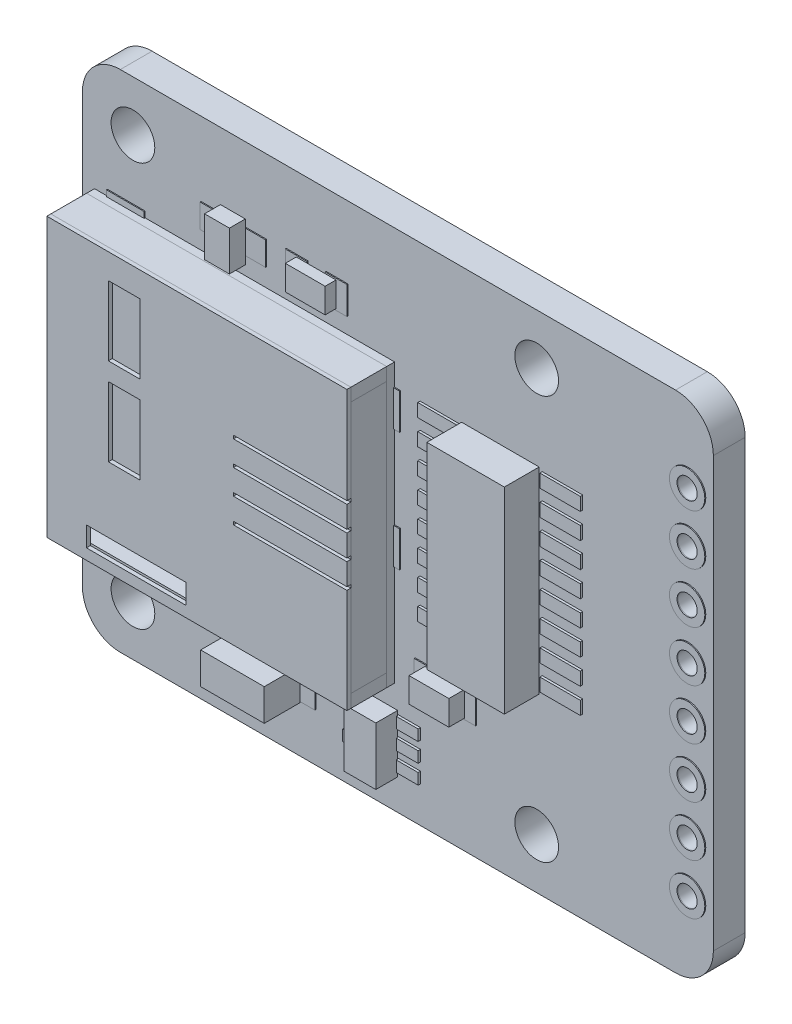
from build123d import *

# Parameters (mm, degrees)
ESQUISSE1_R                                    = 1.1
ESQUISSE1_R_2                                  = 0.508
PCB_ADAFRUIT_EAGLE_31_75X25_4_EP_ESTIMEE_DEPTH = 1.6
MICROSD_BASE_H_ESTIMEE_START                   = 1.6
ESQUISSE2_W                                    = 15.1
ESQUISSE2_H                                    = 14
MICROSD_BASE_H_ESTIMEE_DEPTH                   = 0.4
MICROSD_FLANCS_START                           = 2
ESQUISSE3_W                                    = 15.1
ESQUISSE3_H                                    = 0.65
MICROSD_FLANCS_DEPTH                           = 1.8
MICROSD_FLANCS_2_DEPTH                         = 1.8
MICROSD_FOND_START                             = 2
ESQUISSE4_W                                    = 0.65
ESQUISSE4_H                                    = 12.7
MICROSD_FOND_DEPTH                             = 1.8
MICROSD_CAPOT_METALLIQUE_START                 = 3.8
ESQUISSE5_W                                    = 15.1
ESQUISSE5_H                                    = 14
MICROSD_CAPOT_METALLIQUE_DEPTH                 = 0.2
FENETRES_CAPOT_SIMPLIFIEES_START               = 4
ESQUISSE6_W                                    = 1.6
ESQUISSE6_H                                    = 3.5
ESQUISSE6_W_2                                  = 5
ESQUISSE6_H_2                                  = 1
FENETRES_CAPOT_SIMPLIFIEES_DEPTH               = 0.2
FENTES_CAPOT_SIMPLIFIEES_START                 = 4
ESQUISSE7_W                                    = 5.8
ESQUISSE7_H                                    = 0.16
FENTES_CAPOT_SIMPLIFIEES_DEPTH                 = 0.2
CONTACTS_MICROSD_SIMPLIFIES_START              = 2
ESQUISSE8_W                                    = 5
ESQUISSE8_H                                    = 0.35
CONTACTS_MICROSD_SIMPLIFIES_DEPTH              = 0.12
CONTACTS_MICROSD_SIMPLIFIES_2_DEPTH            = 0.12
CONTACTS_MICROSD_SIMPLIFIES_3_DEPTH            = 0.12
CONTACTS_MICROSD_SIMPLIFIES_4_DEPTH            = 0.12
CONTACTS_MICROSD_SIMPLIFIES_5_DEPTH            = 0.12
CONTACTS_MICROSD_SIMPLIFIES_6_DEPTH            = 0.12
CONTACTS_MICROSD_SIMPLIFIES_7_DEPTH            = 0.12
CONTACTS_MICROSD_SIMPLIFIES_8_DEPTH            = 0.12
IC1_POSITION_EAGLE_START                       = 1.65
ESQUISSE9_W                                    = 3.9
ESQUISSE9_H                                    = 9.9
IC1_POSITION_EAGLE_DEPTH                       = 1.75
IC2_POSITION_EAGLE_START                       = 1.65
ESQUISSE10_W                                   = 1.6
ESQUISSE10_H                                   = 2.9
IC2_POSITION_EAGLE_DEPTH                       = 1.1
C1_POSITION_EAGLE_START                        = 1.65
ESQUISSE11_W                                   = 3.2
ESQUISSE11_H                                   = 1.6
C1_POSITION_EAGLE_DEPTH                        = 1.8
C2_POSITION_EAGLE_START                        = 1.65
ESQUISSE12_W                                   = 2
ESQUISSE12_H                                   = 1.25
C2_POSITION_EAGLE_DEPTH                        = 0.8
ACT_POSITION_EAGLE_START                       = 1.65
ESQUISSE13_W                                   = 1.25
ESQUISSE13_H                                   = 2
ACT_POSITION_EAGLE_DEPTH                       = 0.8
R1_POSITION_EAGLE_START                        = 1.65
ESQUISSE14_W                                   = 2
ESQUISSE14_H                                   = 1.25
R1_POSITION_EAGLE_DEPTH                        = 0.55
PAD_IC1_0_START                                = 1.6
ESQUISSE15_W                                   = 2.032
ESQUISSE15_H                                   = 0.6604
PAD_IC1_0_DEPTH                                = 0.12
PAD_IC1_1_START                                = 1.6
ESQUISSE16_W                                   = 2.032
ESQUISSE16_H                                   = 0.6604
PAD_IC1_1_DEPTH                                = 0.12
PAD_IC1_2_START                                = 1.6
ESQUISSE17_W                                   = 2.032
ESQUISSE17_H                                   = 0.6604
PAD_IC1_2_DEPTH                                = 0.12
PAD_IC1_3_START                                = 1.6
ESQUISSE18_W                                   = 2.032
ESQUISSE18_H                                   = 0.6604
PAD_IC1_3_DEPTH                                = 0.12
PAD_IC1_4_START                                = 1.6
ESQUISSE19_W                                   = 2.032
ESQUISSE19_H                                   = 0.6604
PAD_IC1_4_DEPTH                                = 0.12
PAD_IC1_5_START                                = 1.6
ESQUISSE20_W                                   = 2.032
ESQUISSE20_H                                   = 0.6604
PAD_IC1_5_DEPTH                                = 0.12
PAD_IC1_6_START                                = 1.6
ESQUISSE21_W                                   = 2.032
ESQUISSE21_H                                   = 0.6604
PAD_IC1_6_DEPTH                                = 0.12
PAD_IC1_7_START                                = 1.6
ESQUISSE22_W                                   = 2.032
ESQUISSE22_H                                   = 0.6604
PAD_IC1_7_DEPTH                                = 0.12
PAD_IC1_8_START                                = 1.6
ESQUISSE23_W                                   = 2.032
ESQUISSE23_H                                   = 0.6604
PAD_IC1_8_DEPTH                                = 0.12
PAD_IC1_9_START                                = 1.6
ESQUISSE24_W                                   = 2.032
ESQUISSE24_H                                   = 0.6604
PAD_IC1_9_DEPTH                                = 0.12
PAD_IC1_10_START                               = 1.6
ESQUISSE25_W                                   = 2.032
ESQUISSE25_H                                   = 0.6604
PAD_IC1_10_DEPTH                               = 0.12
PAD_IC1_11_START                               = 1.6
ESQUISSE26_W                                   = 2.032
ESQUISSE26_H                                   = 0.6604
PAD_IC1_11_DEPTH                               = 0.12
PAD_IC1_12_START                               = 1.6
ESQUISSE27_W                                   = 2.032
ESQUISSE27_H                                   = 0.6604
PAD_IC1_12_DEPTH                               = 0.12
PAD_IC1_13_START                               = 1.6
ESQUISSE28_W                                   = 2.032
ESQUISSE28_H                                   = 0.6604
PAD_IC1_13_DEPTH                               = 0.12
PAD_IC1_14_START                               = 1.6
ESQUISSE29_W                                   = 2.032
ESQUISSE29_H                                   = 0.6604
PAD_IC1_14_DEPTH                               = 0.12
PAD_IC1_15_START                               = 1.6
ESQUISSE30_W                                   = 2.032
ESQUISSE30_H                                   = 0.6604
PAD_IC1_15_DEPTH                               = 0.12
PAD_X1_0_START                                 = 1.6
ESQUISSE31_W                                   = 1.9
ESQUISSE31_H                                   = 1.4
PAD_X1_0_DEPTH                                 = 0.05
PAD_X1_1_START                                 = 1.6
ESQUISSE32_W                                   = 1.9
ESQUISSE32_H                                   = 1.4
PAD_X1_1_DEPTH                                 = 0.05
PAD_X1_2_START                                 = 1.6
ESQUISSE33_W                                   = 1.4
ESQUISSE33_H                                   = 1.8
PAD_X1_2_DEPTH                                 = 0.05
PAD_X1_3_START                                 = 1.6
ESQUISSE34_W                                   = 1.4
ESQUISSE34_H                                   = 1.8
PAD_X1_3_DEPTH                                 = 0.05
PAD_X1_4_START                                 = 1.6
ESQUISSE35_W                                   = 1.5
ESQUISSE35_H                                   = 0.7
PAD_X1_4_DEPTH                                 = 0.05
PAD_X1_5_START                                 = 1.6
ESQUISSE36_W                                   = 1.5
ESQUISSE36_H                                   = 0.7
PAD_X1_5_DEPTH                                 = 0.05
PAD_X1_6_START                                 = 1.6
ESQUISSE37_W                                   = 1.5
ESQUISSE37_H                                   = 0.7
PAD_X1_6_DEPTH                                 = 0.05
PAD_X1_7_START                                 = 1.6
ESQUISSE38_W                                   = 1.5
ESQUISSE38_H                                   = 0.7
PAD_X1_7_DEPTH                                 = 0.05
PAD_X1_8_START                                 = 1.6
ESQUISSE39_W                                   = 1.5
ESQUISSE39_H                                   = 0.7
PAD_X1_8_DEPTH                                 = 0.05
PAD_X1_9_START                                 = 1.6
ESQUISSE40_W                                   = 1.5
ESQUISSE40_H                                   = 0.7
PAD_X1_9_DEPTH                                 = 0.05
PAD_X1_10_START                                = 1.6
ESQUISSE41_W                                   = 1.5
ESQUISSE41_H                                   = 0.7
PAD_X1_10_DEPTH                                = 0.05
PAD_X1_11_START                                = 1.6
ESQUISSE42_W                                   = 1.5
ESQUISSE42_H                                   = 0.7
PAD_X1_11_DEPTH                                = 0.05
PAD_IC2_0_START                                = 1.6
ESQUISSE43_W                                   = 1.2
ESQUISSE43_H                                   = 0.55
PAD_IC2_0_DEPTH                                = 0.12
PAD_IC2_1_START                                = 1.6
ESQUISSE44_W                                   = 1.2
ESQUISSE44_H                                   = 0.55
PAD_IC2_1_DEPTH                                = 0.12
PAD_IC2_2_START                                = 1.6
ESQUISSE45_W                                   = 1.2
ESQUISSE45_H                                   = 0.55
PAD_IC2_2_DEPTH                                = 0.12
PAD_IC2_3_START                                = 1.6
ESQUISSE46_W                                   = 1.2
ESQUISSE46_H                                   = 0.55
PAD_IC2_3_DEPTH                                = 0.12
PAD_IC2_4_START                                = 1.6
ESQUISSE47_W                                   = 1.2
ESQUISSE47_H                                   = 0.55
PAD_IC2_4_DEPTH                                = 0.12
PAD_C1_0_START                                 = 1.6
ESQUISSE48_W                                   = 1.95
ESQUISSE48_H                                   = 1.5
PAD_C1_0_DEPTH                                 = 0.05
PAD_C1_1_START                                 = 1.6
ESQUISSE49_W                                   = 1.95
ESQUISSE49_H                                   = 1.5
PAD_C1_1_DEPTH                                 = 0.05
PAD_C2_0_START                                 = 1.6
ESQUISSE50_W                                   = 1.1
ESQUISSE50_H                                   = 1.4
PAD_C2_0_DEPTH                                 = 0.05
PAD_C2_1_START                                 = 1.6
ESQUISSE51_W                                   = 1.1
ESQUISSE51_H                                   = 1.4
PAD_C2_1_DEPTH                                 = 0.05
ANNEAU_JP1_0_START                             = 1.6
ESQUISSE52_R                                   = 0.889
ESQUISSE52_R_2                                 = 0.508
ANNEAU_JP1_0_DEPTH                             = 0.05
ANNEAU_JP1_1_START                             = 1.6
ESQUISSE53_R                                   = 0.889
ESQUISSE53_R_2                                 = 0.508
ANNEAU_JP1_1_DEPTH                             = 0.05
ANNEAU_JP1_2_START                             = 1.6
ESQUISSE54_R                                   = 0.889
ESQUISSE54_R_2                                 = 0.508
ANNEAU_JP1_2_DEPTH                             = 0.05
ANNEAU_JP1_3_START                             = 1.6
ESQUISSE55_R                                   = 0.889
ESQUISSE55_R_2                                 = 0.508
ANNEAU_JP1_3_DEPTH                             = 0.05
ANNEAU_JP1_4_START                             = 1.6
ESQUISSE56_R                                   = 0.889
ESQUISSE56_R_2                                 = 0.508
ANNEAU_JP1_4_DEPTH                             = 0.05
ANNEAU_JP1_5_START                             = 1.6
ESQUISSE57_R                                   = 0.889
ESQUISSE57_R_2                                 = 0.508
ANNEAU_JP1_5_DEPTH                             = 0.05
ANNEAU_JP1_6_START                             = 1.6
ESQUISSE58_R                                   = 0.889
ESQUISSE58_R_2                                 = 0.508
ANNEAU_JP1_6_DEPTH                             = 0.05
ANNEAU_JP1_7_START                             = 1.6
ESQUISSE59_R                                   = 0.889
ESQUISSE59_R_2                                 = 0.508
ANNEAU_JP1_7_DEPTH                             = 0.05
PAD_ACT_0_START                                = 1.6
ESQUISSE60_W                                   = 1.2
ESQUISSE60_H                                   = 1.2
PAD_ACT_0_DEPTH                                = 0.05
PAD_ACT_1_START                                = 1.6
ESQUISSE61_W                                   = 1.2
ESQUISSE61_H                                   = 1.2
PAD_ACT_1_DEPTH                                = 0.05
PAD_R1_0_START                                 = 1.6
ESQUISSE62_W                                   = 1.1
ESQUISSE62_H                                   = 1.4
PAD_R1_0_DEPTH                                 = 0.05
PAD_R1_1_START                                 = 1.6
ESQUISSE63_W                                   = 1.1
ESQUISSE63_H                                   = 1.4
PAD_R1_1_DEPTH                                 = 0.05


with BuildPart() as part:
    # Esquisse1 → PCB_Adafruit_Eagle_31_75x25_4_ep_ESTIMEE1_6 (new body)
    with BuildSketch(Plane.XY):
        with BuildLine():
            Line((29.845, 0), (1.905, 0))
            ThreePointArc((1.905, 0), (0.557961582, 0.557961582), (0, 1.905))
            Line((0, 1.905), (0, 23.495))
            ThreePointArc((0, 23.495), (0.557961582, 24.842038418), (1.905, 25.4))
            Line((1.905, 25.4), (29.845, 25.4))
            ThreePointArc((29.845, 25.4), (31.192038418, 24.842038418), (31.75, 23.495))
            Line((31.75, 23.495), (31.75, 1.905))
            ThreePointArc((31.75, 1.905), (31.192038418, 0.557961582), (29.845, 0))
        make_face()
        with Locations((2.54, 22.86)):
            Circle(ESQUISSE1_R, mode=Mode.SUBTRACT)
        with Locations((2.54, 2.54)):
            Circle(ESQUISSE1_R, mode=Mode.SUBTRACT)
        with Locations((22.86, 22.86)):
            Circle(ESQUISSE1_R, mode=Mode.SUBTRACT)
        with Locations((22.86, 2.54)):
            Circle(ESQUISSE1_R, mode=Mode.SUBTRACT)
        with Locations((30.48, 3.683)):
            Circle(ESQUISSE1_R_2, mode=Mode.SUBTRACT)
        with Locations((30.48, 6.223)):
            Circle(ESQUISSE1_R_2, mode=Mode.SUBTRACT)
        with Locations((30.48, 8.763)):
            Circle(ESQUISSE1_R_2, mode=Mode.SUBTRACT)
        with Locations((30.48, 11.303)):
            Circle(ESQUISSE1_R_2, mode=Mode.SUBTRACT)
        with Locations((30.48, 13.843)):
            Circle(ESQUISSE1_R_2, mode=Mode.SUBTRACT)
        with Locations((30.48, 16.383)):
            Circle(ESQUISSE1_R_2, mode=Mode.SUBTRACT)
        with Locations((30.48, 18.923)):
            Circle(ESQUISSE1_R_2, mode=Mode.SUBTRACT)
        with Locations((30.48, 21.463)):
            Circle(ESQUISSE1_R_2, mode=Mode.SUBTRACT)
    extrude(amount=PCB_ADAFRUIT_EAGLE_31_75X25_4_EP_ESTIMEE_DEPTH)


with BuildPart() as body_2:
    # Esquisse2 → MicroSD_base_H_ESTIMEE (new body)
    with BuildSketch(Plane.XY.offset(MICROSD_BASE_H_ESTIMEE_START)):
        with Locations((8.158, 12.558)):
            Rectangle(ESQUISSE2_W, ESQUISSE2_H)
    extrude(amount=MICROSD_BASE_H_ESTIMEE_DEPTH)


with BuildPart() as body_3:
    # Esquisse3 → MicroSD_flancs (new body)
    with BuildSketch(Plane.XY.offset(MICROSD_FLANCS_START)):
        with Locations((8.158, 5.883)):
            Rectangle(ESQUISSE3_W, ESQUISSE3_H)
    extrude(amount=MICROSD_FLANCS_DEPTH)


with BuildPart() as body_4:
    # Esquisse3 → MicroSD_flancs 2 (new body)
    with BuildSketch(Plane.XY.offset(MICROSD_FLANCS_START)):
        with Locations((8.158, 19.233)):
            Rectangle(ESQUISSE3_W, ESQUISSE3_H)
    extrude(amount=MICROSD_FLANCS_2_DEPTH)


with BuildPart() as body_5:
    # Esquisse4 → MicroSD_fond (new body)
    with BuildSketch(Plane.XY.offset(MICROSD_FOND_START)):
        with Locations((15.383, 12.558)):
            Rectangle(ESQUISSE4_W, ESQUISSE4_H)
    extrude(amount=MICROSD_FOND_DEPTH)


with BuildPart() as body_6:
    # Esquisse5 → MicroSD_capot_metallique (new body)
    with BuildSketch(Plane.XY.offset(MICROSD_CAPOT_METALLIQUE_START)):
        with Locations((8.158, 12.558)):
            Rectangle(ESQUISSE5_W, ESQUISSE5_H)
    extrude(amount=MICROSD_CAPOT_METALLIQUE_DEPTH)

    # Esquisse6 → Fenetres_capot_simplifiees (cut)
    with BuildSketch(Plane.XY.offset(FENETRES_CAPOT_SIMPLIFIEES_START)):
        with Locations((4.5, 12.15)):
            Rectangle(ESQUISSE6_W, ESQUISSE6_H)
        with Locations((4.5, 16.55)):
            Rectangle(ESQUISSE6_W, ESQUISSE6_H)
        with Locations((5.1, 6.6)):
            Rectangle(ESQUISSE6_W_2, ESQUISSE6_H_2)
    extrude(amount=-FENETRES_CAPOT_SIMPLIFIEES_DEPTH, mode=Mode.SUBTRACT)

    # Esquisse7 → Fentes_capot_simplifiees (cut)
    with BuildSketch(Plane.XY.offset(FENTES_CAPOT_SIMPLIFIEES_START)):
        with Locations((12.9, 10.88)):
            Rectangle(ESQUISSE7_W, ESQUISSE7_H)
        with Locations((12.9, 12.13)):
            Rectangle(ESQUISSE7_W, ESQUISSE7_H)
        with Locations((12.9, 13.38)):
            Rectangle(ESQUISSE7_W, ESQUISSE7_H)
        with Locations((12.9, 14.63)):
            Rectangle(ESQUISSE7_W, ESQUISSE7_H)
    extrude(amount=-FENTES_CAPOT_SIMPLIFIEES_DEPTH, mode=Mode.SUBTRACT)


with BuildPart() as body_7:
    # Esquisse8 → Contacts_microSD_simplifies (new body)
    with BuildSketch(Plane.XY.offset(CONTACTS_MICROSD_SIMPLIFIES_START)):
        with Locations((7, 10.383)):
            Rectangle(ESQUISSE8_W, ESQUISSE8_H)
    extrude(amount=CONTACTS_MICROSD_SIMPLIFIES_DEPTH)


with BuildPart() as body_8:
    # Esquisse8 → Contacts_microSD_simplifies 2 (new body)
    with BuildSketch(Plane.XY.offset(CONTACTS_MICROSD_SIMPLIFIES_START)):
        with Locations((7, 11.483)):
            Rectangle(ESQUISSE8_W, ESQUISSE8_H)
    extrude(amount=CONTACTS_MICROSD_SIMPLIFIES_2_DEPTH)


with BuildPart() as body_9:
    # Esquisse8 → Contacts_microSD_simplifies 3 (new body)
    with BuildSketch(Plane.XY.offset(CONTACTS_MICROSD_SIMPLIFIES_START)):
        with Locations((7, 12.583)):
            Rectangle(ESQUISSE8_W, ESQUISSE8_H)
    extrude(amount=CONTACTS_MICROSD_SIMPLIFIES_3_DEPTH)


with BuildPart() as body_10:
    # Esquisse8 → Contacts_microSD_simplifies 4 (new body)
    with BuildSketch(Plane.XY.offset(CONTACTS_MICROSD_SIMPLIFIES_START)):
        with Locations((7, 13.683)):
            Rectangle(ESQUISSE8_W, ESQUISSE8_H)
    extrude(amount=CONTACTS_MICROSD_SIMPLIFIES_4_DEPTH)


with BuildPart() as body_11:
    # Esquisse8 → Contacts_microSD_simplifies 5 (new body)
    with BuildSketch(Plane.XY.offset(CONTACTS_MICROSD_SIMPLIFIES_START)):
        with Locations((7, 14.783)):
            Rectangle(ESQUISSE8_W, ESQUISSE8_H)
    extrude(amount=CONTACTS_MICROSD_SIMPLIFIES_5_DEPTH)


with BuildPart() as body_12:
    # Esquisse8 → Contacts_microSD_simplifies 6 (new body)
    with BuildSketch(Plane.XY.offset(CONTACTS_MICROSD_SIMPLIFIES_START)):
        with Locations((7, 15.883)):
            Rectangle(ESQUISSE8_W, ESQUISSE8_H)
    extrude(amount=CONTACTS_MICROSD_SIMPLIFIES_6_DEPTH)


with BuildPart() as body_13:
    # Esquisse8 → Contacts_microSD_simplifies 7 (new body)
    with BuildSketch(Plane.XY.offset(CONTACTS_MICROSD_SIMPLIFIES_START)):
        with Locations((7, 16.983)):
            Rectangle(ESQUISSE8_W, ESQUISSE8_H)
    extrude(amount=CONTACTS_MICROSD_SIMPLIFIES_7_DEPTH)


with BuildPart() as body_14:
    # Esquisse8 → Contacts_microSD_simplifies 8 (new body)
    with BuildSketch(Plane.XY.offset(CONTACTS_MICROSD_SIMPLIFIES_START)):
        with Locations((7, 18.083)):
            Rectangle(ESQUISSE8_W, ESQUISSE8_H)
    extrude(amount=CONTACTS_MICROSD_SIMPLIFIES_8_DEPTH)


with BuildPart() as body_15:
    # Esquisse9 → IC1_position_Eagle (new body)
    with BuildSketch(Plane.XY.offset(IC1_POSITION_EAGLE_START)):
        with Locations((21.082, 13.716)):
            Rectangle(ESQUISSE9_W, ESQUISSE9_H)
    extrude(amount=IC1_POSITION_EAGLE_DEPTH)


with BuildPart() as body_16:
    # Esquisse10 → IC2_position_Eagle (new body)
    with BuildSketch(Plane.XY.offset(IC2_POSITION_EAGLE_START)):
        with Locations((15.113, 3.048)):
            Rectangle(ESQUISSE10_W, ESQUISSE10_H)
    extrude(amount=IC2_POSITION_EAGLE_DEPTH)


with BuildPart() as body_17:
    # Esquisse11 → C1_position_Eagle (new body)
    with BuildSketch(Plane.XY.offset(C1_POSITION_EAGLE_START)):
        with Locations((9.398, 3.175)):
            Rectangle(ESQUISSE11_W, ESQUISSE11_H)
    extrude(amount=C1_POSITION_EAGLE_DEPTH)


with BuildPart() as body_18:
    # Esquisse12 → C2_position_Eagle (new body)
    with BuildSketch(Plane.XY.offset(C2_POSITION_EAGLE_START)):
        with Locations((18.288, 6.477)):
            Rectangle(ESQUISSE12_W, ESQUISSE12_H)
    extrude(amount=C2_POSITION_EAGLE_DEPTH)


with BuildPart() as body_19:
    # Esquisse13 → ACT_position_Eagle (new body)
    with BuildSketch(Plane.XY.offset(ACT_POSITION_EAGLE_START)):
        with Locations((7.62, 21.082)):
            Rectangle(ESQUISSE13_W, ESQUISSE13_H)
    extrude(amount=ACT_POSITION_EAGLE_DEPTH)


with BuildPart() as body_20:
    # Esquisse14 → R1_position_Eagle (new body)
    with BuildSketch(Plane.XY.offset(R1_POSITION_EAGLE_START)):
        with Locations((11.811, 21.082)):
            Rectangle(ESQUISSE14_W, ESQUISSE14_H)
    extrude(amount=R1_POSITION_EAGLE_DEPTH)


with BuildPart() as body_21:
    # Esquisse15 → Pad_IC1_0 (new body)
    with BuildSketch(Plane.XY.offset(PAD_IC1_0_START)):
        with Locations((18.0086, 18.161)):
            Rectangle(ESQUISSE15_W, ESQUISSE15_H)
    extrude(amount=PAD_IC1_0_DEPTH)


with BuildPart() as body_22:
    # Esquisse16 → Pad_IC1_1 (new body)
    with BuildSketch(Plane.XY.offset(PAD_IC1_1_START)):
        with Locations((24.1554, 18.161)):
            Rectangle(ESQUISSE16_W, ESQUISSE16_H)
    extrude(amount=PAD_IC1_1_DEPTH)


with BuildPart() as body_23:
    # Esquisse17 → Pad_IC1_2 (new body)
    with BuildSketch(Plane.XY.offset(PAD_IC1_2_START)):
        with Locations((18.0086, 16.891)):
            Rectangle(ESQUISSE17_W, ESQUISSE17_H)
    extrude(amount=PAD_IC1_2_DEPTH)


with BuildPart() as body_24:
    # Esquisse18 → Pad_IC1_3 (new body)
    with BuildSketch(Plane.XY.offset(PAD_IC1_3_START)):
        with Locations((18.0086, 15.621)):
            Rectangle(ESQUISSE18_W, ESQUISSE18_H)
    extrude(amount=PAD_IC1_3_DEPTH)


with BuildPart() as body_25:
    # Esquisse19 → Pad_IC1_4 (new body)
    with BuildSketch(Plane.XY.offset(PAD_IC1_4_START)):
        with Locations((24.1554, 16.891)):
            Rectangle(ESQUISSE19_W, ESQUISSE19_H)
    extrude(amount=PAD_IC1_4_DEPTH)


with BuildPart() as body_26:
    # Esquisse20 → Pad_IC1_5 (new body)
    with BuildSketch(Plane.XY.offset(PAD_IC1_5_START)):
        with Locations((24.1554, 15.621)):
            Rectangle(ESQUISSE20_W, ESQUISSE20_H)
    extrude(amount=PAD_IC1_5_DEPTH)


with BuildPart() as body_27:
    # Esquisse21 → Pad_IC1_6 (new body)
    with BuildSketch(Plane.XY.offset(PAD_IC1_6_START)):
        with Locations((18.0086, 14.351)):
            Rectangle(ESQUISSE21_W, ESQUISSE21_H)
    extrude(amount=PAD_IC1_6_DEPTH)


with BuildPart() as body_28:
    # Esquisse22 → Pad_IC1_7 (new body)
    with BuildSketch(Plane.XY.offset(PAD_IC1_7_START)):
        with Locations((24.1554, 14.351)):
            Rectangle(ESQUISSE22_W, ESQUISSE22_H)
    extrude(amount=PAD_IC1_7_DEPTH)


with BuildPart() as body_29:
    # Esquisse23 → Pad_IC1_8 (new body)
    with BuildSketch(Plane.XY.offset(PAD_IC1_8_START)):
        with Locations((18.0086, 13.081)):
            Rectangle(ESQUISSE23_W, ESQUISSE23_H)
    extrude(amount=PAD_IC1_8_DEPTH)


with BuildPart() as body_30:
    # Esquisse24 → Pad_IC1_9 (new body)
    with BuildSketch(Plane.XY.offset(PAD_IC1_9_START)):
        with Locations((24.1554, 13.081)):
            Rectangle(ESQUISSE24_W, ESQUISSE24_H)
    extrude(amount=PAD_IC1_9_DEPTH)


with BuildPart() as body_31:
    # Esquisse25 → Pad_IC1_10 (new body)
    with BuildSketch(Plane.XY.offset(PAD_IC1_10_START)):
        with Locations((18.0086, 11.811)):
            Rectangle(ESQUISSE25_W, ESQUISSE25_H)
    extrude(amount=PAD_IC1_10_DEPTH)


with BuildPart() as body_32:
    # Esquisse26 → Pad_IC1_11 (new body)
    with BuildSketch(Plane.XY.offset(PAD_IC1_11_START)):
        with Locations((18.0086, 10.541)):
            Rectangle(ESQUISSE26_W, ESQUISSE26_H)
    extrude(amount=PAD_IC1_11_DEPTH)


with BuildPart() as body_33:
    # Esquisse27 → Pad_IC1_12 (new body)
    with BuildSketch(Plane.XY.offset(PAD_IC1_12_START)):
        with Locations((24.1554, 11.811)):
            Rectangle(ESQUISSE27_W, ESQUISSE27_H)
    extrude(amount=PAD_IC1_12_DEPTH)


with BuildPart() as body_34:
    # Esquisse28 → Pad_IC1_13 (new body)
    with BuildSketch(Plane.XY.offset(PAD_IC1_13_START)):
        with Locations((24.1554, 10.541)):
            Rectangle(ESQUISSE28_W, ESQUISSE28_H)
    extrude(amount=PAD_IC1_13_DEPTH)


with BuildPart() as body_35:
    # Esquisse29 → Pad_IC1_14 (new body)
    with BuildSketch(Plane.XY.offset(PAD_IC1_14_START)):
        with Locations((18.0086, 9.271)):
            Rectangle(ESQUISSE29_W, ESQUISSE29_H)
    extrude(amount=PAD_IC1_14_DEPTH)


with BuildPart() as body_36:
    # Esquisse30 → Pad_IC1_15 (new body)
    with BuildSketch(Plane.XY.offset(PAD_IC1_15_START)):
        with Locations((24.1554, 9.271)):
            Rectangle(ESQUISSE30_W, ESQUISSE30_H)
    extrude(amount=PAD_IC1_15_DEPTH)


with BuildPart() as body_37:
    # Esquisse31 → Pad_X1_0 (new body)
    with BuildSketch(Plane.XY.offset(PAD_X1_0_START)):
        with Locations((2.208, 19.158)):
            Rectangle(ESQUISSE31_W, ESQUISSE31_H)
    extrude(amount=PAD_X1_0_DEPTH)


with BuildPart() as body_38:
    # Esquisse32 → Pad_X1_1 (new body)
    with BuildSketch(Plane.XY.offset(PAD_X1_1_START)):
        with Locations((1.308, 5.958)):
            Rectangle(ESQUISSE32_W, ESQUISSE32_H)
    extrude(amount=PAD_X1_1_DEPTH)


with BuildPart() as body_39:
    # Esquisse33 → Pad_X1_2 (new body)
    with BuildSketch(Plane.XY.offset(PAD_X1_2_START)):
        with Locations((15.308, 17.558)):
            Rectangle(ESQUISSE33_W, ESQUISSE33_H)
    extrude(amount=PAD_X1_2_DEPTH)


with BuildPart() as body_40:
    # Esquisse34 → Pad_X1_3 (new body)
    with BuildSketch(Plane.XY.offset(PAD_X1_3_START)):
        with Locations((15.308, 11.558)):
            Rectangle(ESQUISSE34_W, ESQUISSE34_H)
    extrude(amount=PAD_X1_3_DEPTH)


with BuildPart() as body_41:
    # Esquisse35 → Pad_X1_4 (new body)
    with BuildSketch(Plane.XY.offset(PAD_X1_4_START)):
        with Locations((5.108, 18.258)):
            Rectangle(ESQUISSE35_W, ESQUISSE35_H)
    extrude(amount=PAD_X1_4_DEPTH)


with BuildPart() as body_42:
    # Esquisse36 → Pad_X1_5 (new body)
    with BuildSketch(Plane.XY.offset(PAD_X1_5_START)):
        with Locations((5.108, 17.158)):
            Rectangle(ESQUISSE36_W, ESQUISSE36_H)
    extrude(amount=PAD_X1_5_DEPTH)


with BuildPart() as body_43:
    # Esquisse37 → Pad_X1_6 (new body)
    with BuildSketch(Plane.XY.offset(PAD_X1_6_START)):
        with Locations((4.708, 16.058)):
            Rectangle(ESQUISSE37_W, ESQUISSE37_H)
    extrude(amount=PAD_X1_6_DEPTH)


with BuildPart() as body_44:
    # Esquisse38 → Pad_X1_7 (new body)
    with BuildSketch(Plane.XY.offset(PAD_X1_7_START)):
        with Locations((5.108, 14.958)):
            Rectangle(ESQUISSE38_W, ESQUISSE38_H)
    extrude(amount=PAD_X1_7_DEPTH)


with BuildPart() as body_45:
    # Esquisse39 → Pad_X1_8 (new body)
    with BuildSketch(Plane.XY.offset(PAD_X1_8_START)):
        with Locations((4.708, 13.858)):
            Rectangle(ESQUISSE39_W, ESQUISSE39_H)
    extrude(amount=PAD_X1_8_DEPTH)


with BuildPart() as body_46:
    # Esquisse40 → Pad_X1_9 (new body)
    with BuildSketch(Plane.XY.offset(PAD_X1_9_START)):
        with Locations((5.108, 12.758)):
            Rectangle(ESQUISSE40_W, ESQUISSE40_H)
    extrude(amount=PAD_X1_9_DEPTH)


with BuildPart() as body_47:
    # Esquisse41 → Pad_X1_10 (new body)
    with BuildSketch(Plane.XY.offset(PAD_X1_10_START)):
        with Locations((5.508, 11.658)):
            Rectangle(ESQUISSE41_W, ESQUISSE41_H)
    extrude(amount=PAD_X1_10_DEPTH)


with BuildPart() as body_48:
    # Esquisse42 → Pad_X1_11 (new body)
    with BuildSketch(Plane.XY.offset(PAD_X1_11_START)):
        with Locations((5.108, 10.558)):
            Rectangle(ESQUISSE42_W, ESQUISSE42_H)
    extrude(amount=PAD_X1_11_DEPTH)


with BuildPart() as body_49:
    # Esquisse43 → Pad_IC2_0 (new body)
    with BuildSketch(Plane.XY.offset(PAD_IC2_0_START)):
        with Locations((16.413, 2.098)):
            Rectangle(ESQUISSE43_W, ESQUISSE43_H)
    extrude(amount=PAD_IC2_0_DEPTH)


with BuildPart() as body_50:
    # Esquisse44 → Pad_IC2_1 (new body)
    with BuildSketch(Plane.XY.offset(PAD_IC2_1_START)):
        with Locations((16.413, 3.048)):
            Rectangle(ESQUISSE44_W, ESQUISSE44_H)
    extrude(amount=PAD_IC2_1_DEPTH)


with BuildPart() as body_51:
    # Esquisse45 → Pad_IC2_2 (new body)
    with BuildSketch(Plane.XY.offset(PAD_IC2_2_START)):
        with Locations((16.413, 3.998)):
            Rectangle(ESQUISSE45_W, ESQUISSE45_H)
    extrude(amount=PAD_IC2_2_DEPTH)


with BuildPart() as body_52:
    # Esquisse46 → Pad_IC2_3 (new body)
    with BuildSketch(Plane.XY.offset(PAD_IC2_3_START)):
        with Locations((13.813, 3.998)):
            Rectangle(ESQUISSE46_W, ESQUISSE46_H)
    extrude(amount=PAD_IC2_3_DEPTH)


with BuildPart() as body_53:
    # Esquisse47 → Pad_IC2_4 (new body)
    with BuildSketch(Plane.XY.offset(PAD_IC2_4_START)):
        with Locations((13.813, 2.098)):
            Rectangle(ESQUISSE47_W, ESQUISSE47_H)
    extrude(amount=PAD_IC2_4_DEPTH)


with BuildPart() as body_54:
    # Esquisse48 → Pad_C1_0 (new body)
    with BuildSketch(Plane.XY.offset(PAD_C1_0_START)):
        with Locations((10.773, 3.175)):
            Rectangle(ESQUISSE48_W, ESQUISSE48_H)
    extrude(amount=PAD_C1_0_DEPTH)


with BuildPart() as body_55:
    # Esquisse49 → Pad_C1_1 (new body)
    with BuildSketch(Plane.XY.offset(PAD_C1_1_START)):
        with Locations((8.023, 3.175)):
            Rectangle(ESQUISSE49_W, ESQUISSE49_H)
    extrude(amount=PAD_C1_1_DEPTH)


with BuildPart() as body_56:
    # Esquisse50 → Pad_C2_0 (new body)
    with BuildSketch(Plane.XY.offset(PAD_C2_0_START)):
        with Locations((17.288, 6.477)):
            Rectangle(ESQUISSE50_W, ESQUISSE50_H)
    extrude(amount=PAD_C2_0_DEPTH)


with BuildPart() as body_57:
    # Esquisse51 → Pad_C2_1 (new body)
    with BuildSketch(Plane.XY.offset(PAD_C2_1_START)):
        with Locations((19.288, 6.477)):
            Rectangle(ESQUISSE51_W, ESQUISSE51_H)
    extrude(amount=PAD_C2_1_DEPTH)


with BuildPart() as body_58:
    # Esquisse52 → Anneau_JP1_0 (new body)
    with BuildSketch(Plane.XY.offset(ANNEAU_JP1_0_START)):
        with Locations((30.48, 3.683)):
            Circle(ESQUISSE52_R)
        with Locations((30.48, 3.683)):
            Circle(ESQUISSE52_R_2, mode=Mode.SUBTRACT)
    extrude(amount=ANNEAU_JP1_0_DEPTH)


with BuildPart() as body_59:
    # Esquisse53 → Anneau_JP1_1 (new body)
    with BuildSketch(Plane.XY.offset(ANNEAU_JP1_1_START)):
        with Locations((30.48, 6.223)):
            Circle(ESQUISSE53_R)
        with Locations((30.48, 6.223)):
            Circle(ESQUISSE53_R_2, mode=Mode.SUBTRACT)
    extrude(amount=ANNEAU_JP1_1_DEPTH)


with BuildPart() as body_60:
    # Esquisse54 → Anneau_JP1_2 (new body)
    with BuildSketch(Plane.XY.offset(ANNEAU_JP1_2_START)):
        with Locations((30.48, 8.763)):
            Circle(ESQUISSE54_R)
        with Locations((30.48, 8.763)):
            Circle(ESQUISSE54_R_2, mode=Mode.SUBTRACT)
    extrude(amount=ANNEAU_JP1_2_DEPTH)


with BuildPart() as body_61:
    # Esquisse55 → Anneau_JP1_3 (new body)
    with BuildSketch(Plane.XY.offset(ANNEAU_JP1_3_START)):
        with Locations((30.48, 11.303)):
            Circle(ESQUISSE55_R)
        with Locations((30.48, 11.303)):
            Circle(ESQUISSE55_R_2, mode=Mode.SUBTRACT)
    extrude(amount=ANNEAU_JP1_3_DEPTH)


with BuildPart() as body_62:
    # Esquisse56 → Anneau_JP1_4 (new body)
    with BuildSketch(Plane.XY.offset(ANNEAU_JP1_4_START)):
        with Locations((30.48, 13.843)):
            Circle(ESQUISSE56_R)
        with Locations((30.48, 13.843)):
            Circle(ESQUISSE56_R_2, mode=Mode.SUBTRACT)
    extrude(amount=ANNEAU_JP1_4_DEPTH)


with BuildPart() as body_63:
    # Esquisse57 → Anneau_JP1_5 (new body)
    with BuildSketch(Plane.XY.offset(ANNEAU_JP1_5_START)):
        with Locations((30.48, 16.383)):
            Circle(ESQUISSE57_R)
        with Locations((30.48, 16.383)):
            Circle(ESQUISSE57_R_2, mode=Mode.SUBTRACT)
    extrude(amount=ANNEAU_JP1_5_DEPTH)


with BuildPart() as body_64:
    # Esquisse58 → Anneau_JP1_6 (new body)
    with BuildSketch(Plane.XY.offset(ANNEAU_JP1_6_START)):
        with Locations((30.48, 18.923)):
            Circle(ESQUISSE58_R)
        with Locations((30.48, 18.923)):
            Circle(ESQUISSE58_R_2, mode=Mode.SUBTRACT)
    extrude(amount=ANNEAU_JP1_6_DEPTH)


with BuildPart() as body_65:
    # Esquisse59 → Anneau_JP1_7 (new body)
    with BuildSketch(Plane.XY.offset(ANNEAU_JP1_7_START)):
        with Locations((30.48, 21.463)):
            Circle(ESQUISSE59_R)
        with Locations((30.48, 21.463)):
            Circle(ESQUISSE59_R_2, mode=Mode.SUBTRACT)
    extrude(amount=ANNEAU_JP1_7_DEPTH)


with BuildPart() as body_66:
    # Esquisse60 → Pad_ACT_0 (new body)
    with BuildSketch(Plane.XY.offset(PAD_ACT_0_START)):
        with Locations((8.67, 21.082)):
            Rectangle(ESQUISSE60_W, ESQUISSE60_H)
    extrude(amount=PAD_ACT_0_DEPTH)


with BuildPart() as body_67:
    # Esquisse61 → Pad_ACT_1 (new body)
    with BuildSketch(Plane.XY.offset(PAD_ACT_1_START)):
        with Locations((6.57, 21.082)):
            Rectangle(ESQUISSE61_W, ESQUISSE61_H)
    extrude(amount=PAD_ACT_1_DEPTH)


with BuildPart() as body_68:
    # Esquisse62 → Pad_R1_0 (new body)
    with BuildSketch(Plane.XY.offset(PAD_R1_0_START)):
        with Locations((12.811, 21.082)):
            Rectangle(ESQUISSE62_W, ESQUISSE62_H)
    extrude(amount=PAD_R1_0_DEPTH)


with BuildPart() as body_69:
    # Esquisse63 → Pad_R1_1 (new body)
    with BuildSketch(Plane.XY.offset(PAD_R1_1_START)):
        with Locations((10.811, 21.082)):
            Rectangle(ESQUISSE63_W, ESQUISSE63_H)
    extrude(amount=PAD_R1_1_DEPTH)


solid = Compound([part.part, body_2.part, body_3.part, body_4.part, body_5.part, body_6.part, body_7.part, body_8.part, body_9.part, body_10.part, body_11.part, body_12.part, body_13.part, body_14.part, body_15.part, body_16.part, body_17.part, body_18.part, body_19.part, body_20.part, body_21.part, body_22.part, body_23.part, body_24.part, body_25.part, body_26.part, body_27.part, body_28.part, body_29.part, body_30.part, body_31.part, body_32.part, body_33.part, body_34.part, body_35.part, body_36.part, body_37.part, body_38.part, body_39.part, body_40.part, body_41.part, body_42.part, body_43.part, body_44.part, body_45.part, body_46.part, body_47.part, body_48.part, body_49.part, body_50.part, body_51.part, body_52.part, body_53.part, body_54.part, body_55.part, body_56.part, body_57.part, body_58.part, body_59.part, body_60.part, body_61.part, body_62.part, body_63.part, body_64.part, body_65.part, body_66.part, body_67.part, body_68.part, body_69.part])
